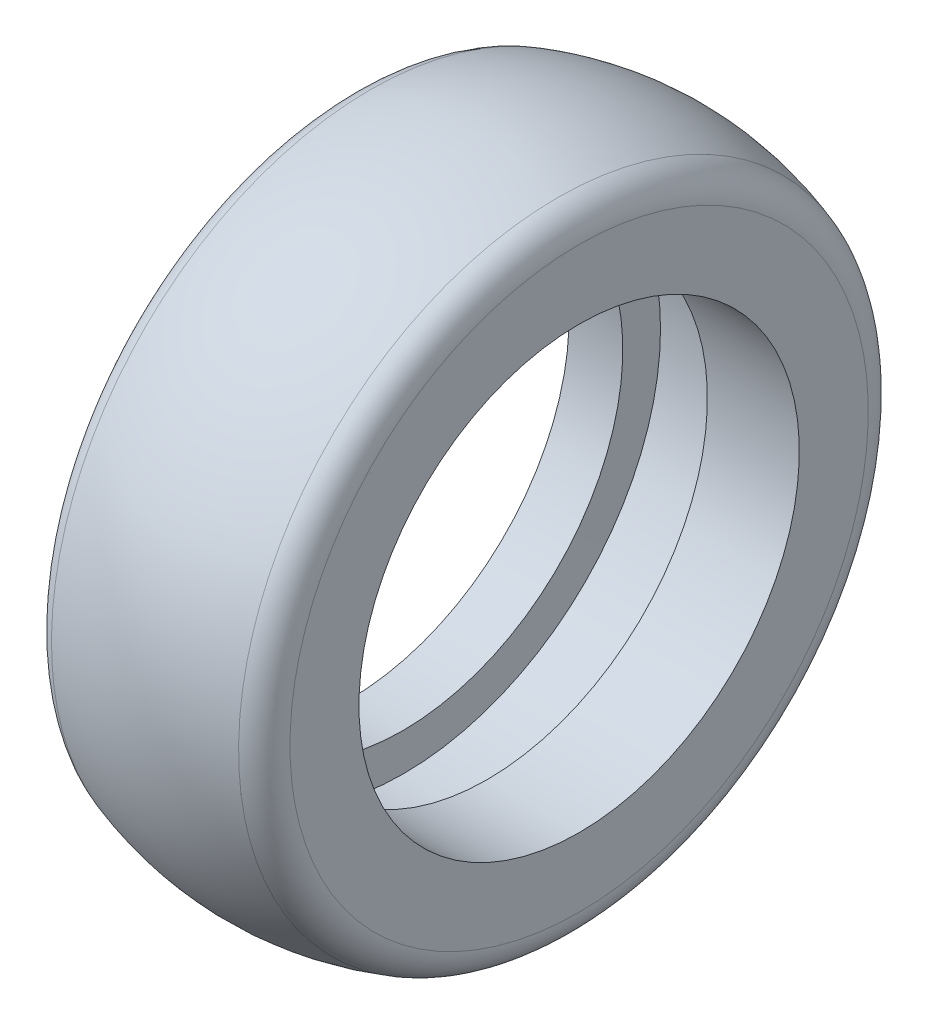
from build123d import *

# Parameters (mm, degrees)
REVOLVE_THIN1_OUTLINE_W   = 10
REVOLVE_THIN1_OUTLINE_H   = 10
REVOLVE_THIN1_OUTLINE_W_2 = 15.028522582
REVOLVE_THIN1_OUTLINE_W_3 = 1.714910115
REVOLVE_THIN1_OUTLINE_W_4 = 33.256567303
REVOLVE_THIN1_OUTLINE_W_5 = 6.885617046
FILLET1_R                 = 30


# Read off the part's stored shape, not the designer's step: Revolve-Thin1
with BuildPart() as part:
    # Revolve-Thin1 outline → Revolve-Thin1 (revolve)
    with BuildSketch(Plane.YX):
        with Locations((215.4, 5)):
            Rectangle(REVOLVE_THIN1_OUTLINE_W, REVOLVE_THIN1_OUTLINE_H)
        with Locations((227.914261291, 5)):
            Rectangle(REVOLVE_THIN1_OUTLINE_W_2, REVOLVE_THIN1_OUTLINE_H)
        Polygon((220.4, 0), (210.4, 0), (210.4, -77.81562954), (220.4, -77.81562954), (220.4, -67.81562954), align=None)
        with Locations((240.428522582, 5)):
            Rectangle(REVOLVE_THIN1_OUTLINE_W, REVOLVE_THIN1_OUTLINE_H)
        with Locations((246.28597764, 5)):
            Rectangle(REVOLVE_THIN1_OUTLINE_W_3, REVOLVE_THIN1_OUTLINE_H)
        with Locations((227.914261291, -72.81562954)):
            Rectangle(REVOLVE_THIN1_OUTLINE_W_2, REVOLVE_THIN1_OUTLINE_H)
        Polygon((220.4, -158.368911943), (210.4, -158.651375691), (210.4, -200), (220.4, -200), (220.4, -168.372900436), align=None)
        with Locations((252.143432697, 5)):
            Rectangle(REVOLVE_THIN1_OUTLINE_W, REVOLVE_THIN1_OUTLINE_H)
        Polygon((245.428522582, -8.479983428), (235.428522582, -8.479983428), (235.428522582, -67.81562954), (235.428522582, -77.81562954), (245.428522582, -77.81562954), (245.428522582, -18.479983428), align=None)
        Polygon((235.428522582, -157.944410663), (220.4, -158.368911943), (220.4, -168.372900436), (235.428522582, -167.948399156), align=None)
        with Locations((215.4, -205)):
            Rectangle(REVOLVE_THIN1_OUTLINE_W, REVOLVE_THIN1_OUTLINE_H)
        with Locations((273.771716349, 5)):
            Rectangle(REVOLVE_THIN1_OUTLINE_W_4, REVOLVE_THIN1_OUTLINE_H)
        with Locations((246.28597764, -13.479983428)):
            Rectangle(REVOLVE_THIN1_OUTLINE_W_3, REVOLVE_THIN1_OUTLINE_H)
        Polygon((245.428522582, -157.661946915), (235.428522582, -157.944410663), (235.428522582, -167.948399156), (235.428522582, -185.030701799), (245.428522582, -185.030701799), (245.428522582, -175.030701799), align=None)
        with Locations((227.914261291, -205)):
            Rectangle(REVOLVE_THIN1_OUTLINE_W_2, REVOLVE_THIN1_OUTLINE_H)
        with Locations((293.842808523, 5)):
            Rectangle(REVOLVE_THIN1_OUTLINE_W_5, REVOLVE_THIN1_OUTLINE_H)
        Polygon((257.143432697, -8.479983428), (247.143432697, -8.479983428), (247.143432697, -18.479983428), (247.143432697, -175.030701799), (247.143432697, -185.030701799), (257.143432697, -185.030701799), align=None)
        with Locations((240.428522582, -205)):
            Rectangle(REVOLVE_THIN1_OUTLINE_W, REVOLVE_THIN1_OUTLINE_H)
        with BuildLine():
            add(Edge.make_bspline(
                [(297.285617046, 10), (298.128725715, 7.792160668), (298.973172441, 5.584730456), (300.24314277, 2.252902336), (300.665122715, 1.127420929), (301.080759322, 0)],
                knots=[0, 0, 0, 0, 0.03125, 0.03125, 0.047149929, 0.047149929, 0.047149929, 0.047149929], degree=3))
            Line((297.285617046, 10), (297.285617046, 0))
            Line((297.285617046, 0), (301.080759322, 0))
        make_face()
        with BuildLine():
            Line((297.285617046, 0), (290.4, 0))
            add(Edge.make_bspline(
                [(290.4, 0), (294.226174379, -10.019560473), (297.285617046, -20.039120946)],
                knots=[0, 0, 0, 0.100195605, 0.100195605, 0.100195605], degree=2))
            Line((297.285617046, -20.039120946), (297.285617046, 0))
        make_face()
        with Locations((246.28597764, -180.030701799)):
            Rectangle(REVOLVE_THIN1_OUTLINE_W_3, REVOLVE_THIN1_OUTLINE_H)
        with Locations((246.28597764, -205)):
            Rectangle(REVOLVE_THIN1_OUTLINE_W_3, REVOLVE_THIN1_OUTLINE_H)
        with BuildLine():
            add(Edge.make_bspline(
                [(301.080759322, 0), (301.482022229, -1.088432041), (301.877372946, -2.178671776), (303.852177937, -7.717233747), (305.338663789, -12.193981744), (308.105692918, -21.210446155), (309.386238407, -25.750161893), (311.146108373, -32.608946585), (311.705902157, -34.903411472), (312.770687134, -39.509097532), (313.275989251, -41.821845227), (317.565497999, -62.682918974), (319.49229443, -81.296552716), (319.493523861, -99.988077296), (319.493524058, -99.994036727), (319.493524058, -99.999996165)],
                knots=[0.047149929, 0.047149929, 0.047149929, 0.047149929, 0.0625, 0.0625, 0.125, 0.125, 0.1875, 0.1875, 0.21875, 0.21875, 0.25, 0.25, 0.5, 0.5, 0.500079733, 0.500079733, 0.500079733, 0.500079733], degree=3))
            Line((301.080759322, 0), (297.285617046, 0))
            Line((297.285617046, 0), (297.285617046, -20.039120946))
            add(Edge.make_bspline(
                [(297.285617046, -20.039120946), (321.701431069, -100), (297.285617046, -179.960879054)],
                knots=[0.100195605, 0.100195605, 0.100195605, 0.899804395, 0.899804395, 0.899804395], degree=2))
            Line((297.285617046, -179.960879054), (297.285617046, -200))
            Line((297.285617046, -200), (301.080759262, -200))
            add(Edge.make_bspline(
                [(319.493524058, -99.999996165), (319.493524261, -109.336842253), (319.012595, -118.691653921), (317.802753291, -130.409396195), (317.530192964, -132.755279331), (316.92393783, -137.449329338), (316.590581813, -139.794326035), (315.504714447, -146.798638914), (314.665186614, -151.437115247), (311.812847999, -165.262865698), (309.466535158, -174.360529261), (305.327261679, -187.840485904), (303.844137072, -192.30603058), (301.87370296, -197.831445048), (301.48019677, -198.916519384), (301.080759262, -200)],
                knots=[0.500079733, 0.500079733, 0.500079733, 0.500079733, 0.625, 0.625, 0.65625, 0.65625, 0.6875, 0.6875, 0.75, 0.75, 0.875, 0.875, 0.9375, 0.9375, 0.952801123, 0.952801123, 0.952801123, 0.952801123], degree=3))
        make_face()
        with Locations((273.771716349, -205)):
            Rectangle(REVOLVE_THIN1_OUTLINE_W_4, REVOLVE_THIN1_OUTLINE_H)
        with Locations((293.842808523, -205)):
            Rectangle(REVOLVE_THIN1_OUTLINE_W_5, REVOLVE_THIN1_OUTLINE_H)
        with BuildLine():
            add(Edge.make_bspline(
                [(297.285617046, -179.960879054), (294.226174379, -189.980439527), (290.4, -200)],
                knots=[0.899804395, 0.899804395, 0.899804395, 1, 1, 1], degree=2))
            Line((290.4, -200), (297.285617046, -200))
            Line((297.285617046, -200), (297.285617046, -179.960879054))
        make_face()
        with Locations((252.143432697, -205)):
            Rectangle(REVOLVE_THIN1_OUTLINE_W, REVOLVE_THIN1_OUTLINE_H)
        with BuildLine():
            Line((301.080759262, -200), (297.285617046, -200))
            Line((297.285617046, -200), (297.285617046, -210))
            add(Edge.make_bspline(
                [(301.080759262, -200), (300.664412042, -201.129348479), (300.241620682, -202.256965445), (298.971515607, -205.588939805), (298.127911115, -207.79429385), (297.285617046, -210)],
                knots=[0.952801123, 0.952801123, 0.952801123, 0.952801123, 0.96875, 0.96875, 1, 1, 1, 1], degree=3))
        make_face()
    revolve(axis=Axis((0, 0, 0), (1, 0, 0)))

    # Fillet1
    fillet1_edges = [part.edges().sort_by_distance(p)[0] for p in [
        (-210, -297.285617046, 0),
        (10, -297.285617046, 0),
    ]]
    fillet(fillet1_edges, radius=FILLET1_R)


solid = part.part
